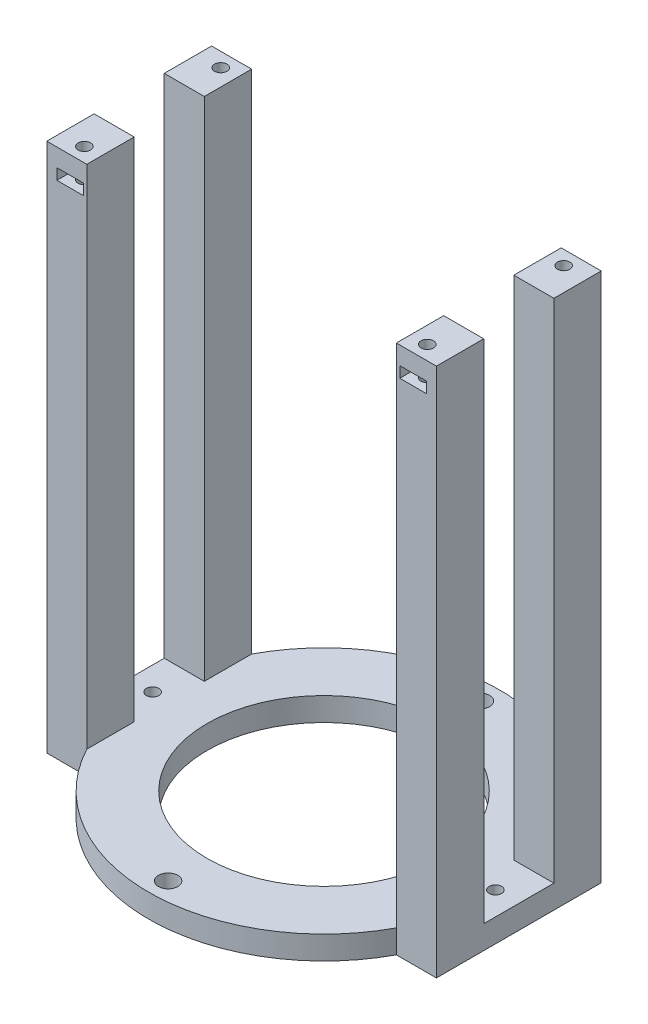
from build123d import *

# Parameters (mm, degrees)
BODY_DEPTH                = 6
SKETCH2_W                 = 10.280011329
SKETCH2_H                 = 42.3
WINGS_DEPTH               = 130
SKETCH3_R                 = 1.6
MOUNTING_BORE_DEPTH       = 152.726728034
CUT_EXCESS_MATERIAL_DEPTH = 175.702604445
CUT_BATTERY_MOUNT_REACH   = 153.727
SKETCH6_R                 = 1.6
SKETCH8_W                 = 6.8
SKETCH8_H                 = 2.8
CAPTURE_NUT_1_DEPTH       = 7.3
CIRPATTERN1_COUNT         = 2
CAPTURE_NUT_2_DEPTH       = 7.3
CIRPATTERN2_COUNT         = 2
CUT_CENTER_HOLE_REACH     = 153.727
SKETCH11_R                = 30
CUT_HARNESS_MOUNT_REACH   = 153.727
SKETCH12_R                = 2.5


with BuildPart() as part:
    # Sketch1 → body (new body)
    with BuildSketch(Plane(origin=(0, 0, 0), x_dir=(1, 0, 0), z_dir=(0, 1, 0))):
        with BuildLine():
            ThreePointArc((-39.719988671, -21.15), (0, -45), (39.719988671, -21.15))
            Line((39.719988671, -21.15), (50, -21.15))
            Line((50, -21.15), (50, 21.15))
            Line((50, 21.15), (39.719988671, 21.15))
            ThreePointArc((39.719988671, 21.15), (0, 45), (-39.719988671, 21.15))
            Line((-39.719988671, 21.15), (-50, 21.15))
            Line((-50, 21.15), (-50, -21.15))
            Line((-50, -21.15), (-39.719988671, -21.15))
        make_face()
    extrude(amount=BODY_DEPTH)

    # Sketch2 → wings (add)
    with BuildSketch(Plane(origin=(0, 6, 0), x_dir=(1, 0, 0), z_dir=(0, 1, 0))):
        with Locations((-44.859994336, 0)):
            Rectangle(SKETCH2_W, SKETCH2_H)
        with Locations((44.859994336, 0)):
            Rectangle(SKETCH2_W, SKETCH2_H)
    extrude(amount=WINGS_DEPTH)

    # Sketch3 → mounting-bore (cut, through all)
    with BuildSketch(Plane(origin=(0, 136, 0), x_dir=(1, 0, 0), z_dir=(0, 1, 0))):
        with Locations((44, -17.5)):
            Circle(SKETCH3_R)
        with Locations((-44, -17.5)):
            Circle(SKETCH3_R)
        with Locations((-44, 17.5)):
            Circle(SKETCH3_R)
        with Locations((44, 17.5)):
            Circle(SKETCH3_R)
    extrude(amount=-MOUNTING_BORE_DEPTH, mode=Mode.SUBTRACT)

    # Sketch5 → cut-excess-material (cut, through all)
    with BuildSketch(Plane(origin=(50, 0, 0), x_dir=(0, 0, -1), z_dir=(1, 0, 0))):
        Polygon((0, 6), (9, 6), (9, 136), (-9, 136), (-9, 6), align=None)
    extrude(amount=-CUT_EXCESS_MATERIAL_DEPTH, mode=Mode.SUBTRACT)

    # Sketch6 → cut-battery-mount (cut, up to next)
    with BuildSketch(Plane.XZ, mode=Mode.PRIVATE) as cut_battery_mount_sk1:
        with Locations((44, 0)):
            Circle(SKETCH6_R)
    cut_battery_mount_tool1 = extrude(cut_battery_mount_sk1.sketch, amount=-CUT_BATTERY_MOUNT_REACH, mode=Mode.PRIVATE) & part.part
    # Sketch6 → cut-battery-mount (cut, up to next)
    with BuildSketch(Plane.XZ, mode=Mode.PRIVATE) as cut_battery_mount_sk2:
        with Locations((-44, 0)):
            Circle(SKETCH6_R)
    cut_battery_mount_tool2 = extrude(cut_battery_mount_sk2.sketch, amount=-CUT_BATTERY_MOUNT_REACH, mode=Mode.PRIVATE) & part.part
    add(cut_battery_mount_tool1.solids().sort_by_distance((44, 0, 0))[0], mode=Mode.SUBTRACT)
    add(cut_battery_mount_tool2.solids().sort_by_distance((-44, 0, 0))[0], mode=Mode.SUBTRACT)

    # Sketch8 → capture-nut-1 (cut)
    with BuildSketch(Plane.XY.offset(21.15)):
        with Locations((43.999988671, 130)):
            Rectangle(SKETCH8_W, SKETCH8_H)
    capture_nut_1 = extrude(amount=-CAPTURE_NUT_1_DEPTH, mode=Mode.SUBTRACT)

    # CirPattern1: capture-nut-1 ×2 about axis
    cirpattern1_axis = Axis((0, 6, 0), (0, 1, 0))
    for i in range(1, CIRPATTERN1_COUNT):
        add(capture_nut_1.rotate(cirpattern1_axis, i * 360 / CIRPATTERN1_COUNT), mode=Mode.SUBTRACT)

    # Sketch10 → capture-nut-2 (cut)
    with BuildSketch(Plane(origin=(0, 0, -21.15), x_dir=(-1, 0, 0), z_dir=(0, 0, -1))):
        Polygon((-43.999988671, 131.4), (-47.399988671, 131.4), (-47.399988671, 128.6), (-40.599988671, 128.6), (-40.599988671, 131.4), align=None)
    capture_nut_2 = extrude(amount=-CAPTURE_NUT_2_DEPTH, mode=Mode.SUBTRACT)

    # CirPattern2: capture-nut-2 ×2 about axis
    cirpattern2_axis = Axis((0, 6, 0), (0, 1, 0))
    for i in range(1, CIRPATTERN2_COUNT):
        add(capture_nut_2.rotate(cirpattern2_axis, i * 360 / CIRPATTERN2_COUNT), mode=Mode.SUBTRACT)

    # Sketch11 → cut-center-hole (cut, up to next)
    with BuildSketch(Plane.XZ, mode=Mode.PRIVATE) as cut_center_hole_sk1:
        Circle(SKETCH11_R)
    cut_center_hole_tool1 = extrude(cut_center_hole_sk1.sketch, amount=-CUT_CENTER_HOLE_REACH, mode=Mode.PRIVATE) & part.part
    add(cut_center_hole_tool1.solids().sort_by_distance((0, 0, 0))[0], mode=Mode.SUBTRACT)

    # Sketch12 → cut-harness-mount (cut, up to next)
    with BuildSketch(Plane.XZ, mode=Mode.PRIVATE) as cut_harness_mount_sk1:
        with Locations((0, -40)):
            Circle(SKETCH12_R)
    cut_harness_mount_tool1 = extrude(cut_harness_mount_sk1.sketch, amount=-CUT_HARNESS_MOUNT_REACH, mode=Mode.PRIVATE) & part.part
    # Sketch12 → cut-harness-mount (cut, up to next)
    with BuildSketch(Plane.XZ, mode=Mode.PRIVATE) as cut_harness_mount_sk2:
        with Locations((0, 40)):
            Circle(SKETCH12_R)
    cut_harness_mount_tool2 = extrude(cut_harness_mount_sk2.sketch, amount=-CUT_HARNESS_MOUNT_REACH, mode=Mode.PRIVATE) & part.part
    add(cut_harness_mount_tool1.solids().sort_by_distance((0, 0, -40))[0], mode=Mode.SUBTRACT)
    add(cut_harness_mount_tool2.solids().sort_by_distance((0, 0, 40))[0], mode=Mode.SUBTRACT)


solid = part.part
